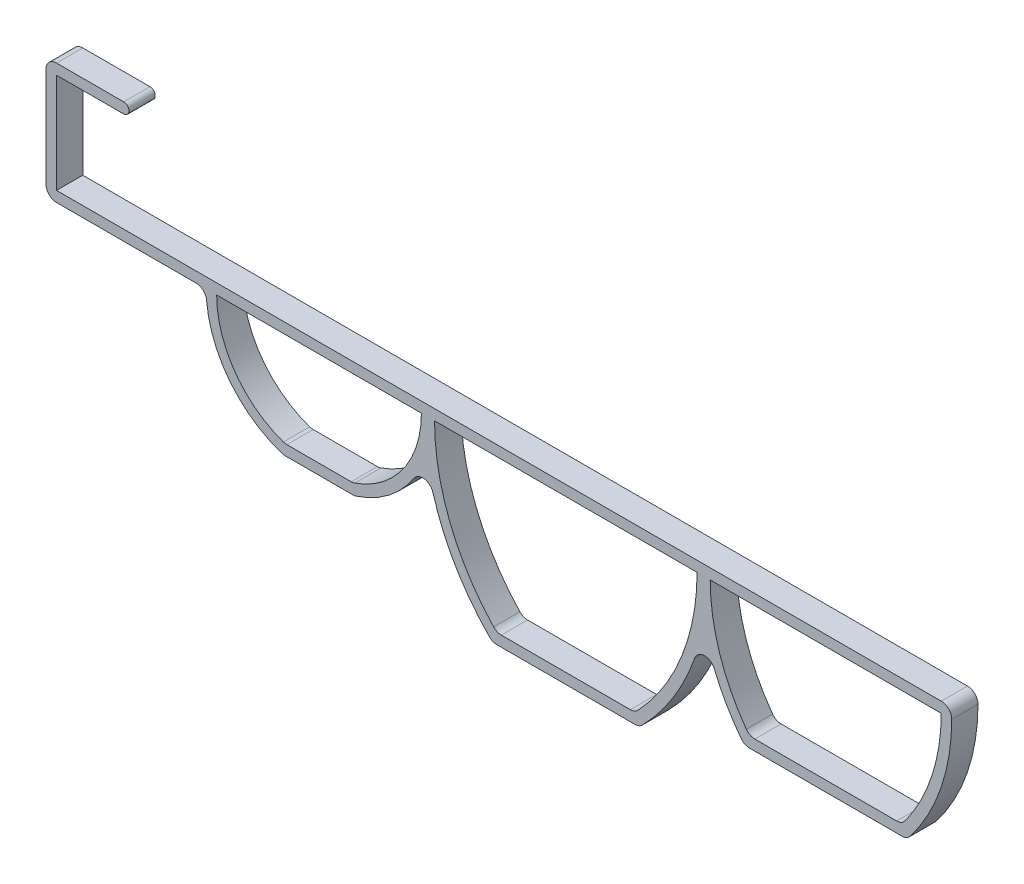
from build123d import *

# Parameters (mm, degrees)
BOSS_EXTRUDE1_DEPTH = 5
FILLET1_R           = 2
FILLET2_R           = 1


with BuildPart() as part:
    # Sketch1 → Boss-Extrude1 (new body)
    with BuildSketch(Plane.XY):
        with BuildLine():
            Line((45.947382797642085, 2), (-124.5, 1.9999999999999962))
            Line((-124.5, 1.9999999999999962), (-124.5, 20.99999999999999))
            Line((-124.5, 20.99999999999999), (-109.6965869966638, 20.999999999999993))
            Line((-109.6965869966638, 20.999999999999993), (-109.6965869966638, 22.99999999999999))
            Line((-109.6965869966638, 22.99999999999999), (-126.5, 22.99999999999999))
            Line((-126.5, 22.99999999999999), (-126.5, -3.98e-15))
            Line((-126.5, -3.98e-15), (-96.00000000000003, -5.01e-15))
            ThreePointArc((-96.00000000000003, -1.3922e-13), (-91.91634498174992, -12.422936572760829), (-81.25831039658792, -19.999999999999993))
            Line((-81.25831039658792, -19.999999999999996), (-67.7416896034121, -19.999999999999996))
            ThreePointArc((-67.7416896034121, -20), (-59.22674645064795, -14.898875979359843), (-54.01801901082011, -6.449326782725662))
            ThreePointArc((-54.01801901082044, -6.449326782725638), (-49.745600463821845, -19.747926884371328), (-41.46929842095424, -31.000000000000007))
            Line((-41.46929842095423, -31), (-13.530701579045768, -31))
            ThreePointArc((-13.530701579045765, -31.000000000000004), (-5.5615533236631265, -20.33765705801185), (-1.1997684126617827, -7.76118245981885))
            ThreePointArc((-1.1997684126617756, -7.761182459818851), (1.6903832669508674, -16.34383705889386), (6.527542114603506, -24))
            Line((6.527542114603509, -24), (37.47245788539651, -24))
            ThreePointArc((37.47245788539651, -24), (44.12729350691807, -11.787963694678155), (45.947382797642085, 2))
        make_face()
        with BuildLine():
            ThreePointArc((-55.000000000000014, -3.1e-16), (-58.606442943263986, -11.117096597214955), (-68.05217786452643, -18))
            Line((-68.05217786452643, -18), (-80.94782213547359, -18))
            ThreePointArc((-80.94782213547359, -18.000000000000004), (-90.39355705673603, -11.117096597214955), (-94, -5.08e-15))
            Line((-94, -5.08e-15), (-55.00000000000001, -3.1e-16))
        make_face(mode=Mode.SUBTRACT)
        with BuildLine():
            ThreePointArc((-2.499999999999993, 0), (-5.579078670022007, -15.665382277262486), (-14.358195797467605, -28.999999999999996))
            Line((-14.358195797467618, -29), (-40.641804202532384, -29))
            ThreePointArc((-40.641804202532384, -29), (-49.420921329978, -15.665382277262491), (-52.500000000000014, 0))
            Line((-52.50000000000001, 0), (-2.5, 0))
        make_face(mode=Mode.SUBTRACT)
        with BuildLine():
            ThreePointArc((7.494737611193308, -21.999999999999993), (1.9251046025075595, -11.620790548201041), (0, 0))
            Line((0, 0), (44, 0))
            ThreePointArc((44, 0), (42.07489539749246, -11.620790548201052), (36.5052623888067, -22))
            Line((36.50526238880669, -22), (7.494737611193305, -21.999999999999986))
        make_face(mode=Mode.SUBTRACT)
    extrude(amount=BOSS_EXTRUDE1_DEPTH)

    # Fillet1
    # the kernel refuses this fillet: 2 mm, written as the material it adds along each edge
    with BuildSketch(Plane(origin=(7.494737611193306, -21.99999999999999, 0), x_dir=(-0.5991062369957058, 0.8006695428157894, 0), z_dir=(0, 0, 1))) as fillet1_piece_1:
        with BuildLine():
            CenterArc((1.0015491764552975, -1.9997957036664622), FILLET1_R, 89.18105145509278, 54.01303517716653)
            Line((-0.5997899091731567, -0.8015832296708748), (0, 0))
            ThreePointArc((0, 0), (0.5150674500576004, 0.00368108195627573), (1.030134900115199, -5e-17))
        make_face()
    extrude(amount=5)
    with BuildSketch(Plane(origin=(36.5052623888067, -22, 0), x_dir=(0.599106236995708, 0.8006695428157878, 0), z_dir=(0, 0, 1))) as fillet1_piece_2:
        with BuildLine():
            CenterArc((1.0015491764552726, 1.9997957036664615), FILLET1_R, 216.80591336773654, 54.01303517717065)
            Line((-0.5997899091732678, 0.8015832296709893), (0, 0))
            ThreePointArc((0, 0), (0.5150674500575887, -0.00368108195627645), (1.0301349001151745, 4e-17))
        make_face()
    extrude(amount=5)
    with BuildSketch(Plane(origin=(-1.1997684126617827, -7.7611824598188495, 0), x_dir=(-0.2559607440844839, -0.9666871766438806, 0), z_dir=(0, 0, 1))) as fillet1_piece_3:
        with BuildLine():
            CenterArc((7.006516264382127, 1.9937618524445377), FILLET1_R, 126.90247774602503, 138.57101311365483)
            ThreePointArc((5.80560665040515, 3.593079237786693), (2.9835854859434217, 1.6660138445939616), (0, 0))
            ThreePointArc((0, 0), (3.424337799359584, 0.13533600091225512), (6.84867559871917, -3e-17))
        make_face()
    extrude(amount=5)
    with BuildSketch(Plane(origin=(-14.358195797467612, -29, 0), x_dir=(0.6930946226970236, 0.720846616131664, 0), z_dir=(0, 0, 1))) as fillet1_piece_4:
        with BuildLine():
            CenterArc((0.8516205484031373, 1.9998888522074818), FILLET1_R, 223.8755770631898, 46.728475963226686)
            Line((-0.5900726838592292, 0.6136996068124346), (0, 0))
            ThreePointArc((0, 0), (0.4363527930685471, -0.00230019269212628), (0.8727055861370968, 1e-17))
        make_face()
    extrude(amount=5)
    with BuildSketch(Plane(origin=(-40.641804202532384, -29, 0), x_dir=(1, 0, 0), z_dir=(0, 0, 1))) as fillet1_piece_5:
        with BuildLine():
            CenterArc((0.8513594890752856, 2), FILLET1_R, 223.27152403673355, 46.72847596326642)
            ThreePointArc((-0.6048675489506863, 0.629086868644805), (-0.3040918605932177, 0.3129491831369968), (0, 0))
            Line((0, 0), (0.8513594890752856, 0))
        make_face()
    extrude(amount=5)
    with BuildSketch(Plane(origin=(-54.01801901082027, -6.449326782725651, 0), x_dir=(-0.4311999989802577, -0.9022563720359229, 0), z_dir=(0, 0, 1))) as fillet1_piece_6:
        with BuildLine():
            CenterArc((5.805573723556372, 1.9824143967569778), FILLET1_R, 131.58462794743895, 130.81175906112728)
            ThreePointArc((4.4781226039186794, 3.478366777340206), (2.2959426874147386, 1.6659530957609738), (0, 0))
            ThreePointArc((0, 0), (2.7704679671233965, 0.18410201579468238), (5.540935934246784, 1.2e-16))
        make_face()
    extrude(amount=5)
    with BuildSketch(Plane(origin=(-68.05217786452643, -18, 0), x_dir=(0.9475954690279733, 0.3194727329173106, 0), z_dir=(0, 0, 1))) as fillet1_piece_7:
        with BuildLine():
            CenterArc((0.3283173010527549, 1.9999162475023402), FILLET1_R, 251.36895898872925, 19.155393135414442)
            Line((-0.31062816478187977, 0.10472530944639823), (0, 0))
            ThreePointArc((0, 0), (0.17331019378626858, -0.00079304447276945), (0.34662038757253955, 0))
        make_face()
    extrude(amount=5)
    with BuildSketch(Plane(origin=(-80.94782213547359, -18.000000000000004, 0), x_dir=(1, 1.084e-14, 0), z_dir=(0, 0, 1))) as fillet1_piece_8:
        with BuildLine():
            CenterArc((0.32780672231424324, 2), FILLET1_R, 250.84460686458493, 19.155393135414442)
            ThreePointArc((-0.32845590873647146, 0.11073576250266372), (-0.1644813104532966, 0.05461639590219925), (0, 0))
            Line((0, 0), (0.3278067223142216, 0))
        make_face()
    extrude(amount=5)
    with BuildSketch(Plane(origin=(-96.00000000000003, -7.212e-14, 0), x_dir=(-1, 3.515e-14, 0), z_dir=(0, 0, 1))) as fillet1_piece_9:
        with BuildLine():
            CenterArc((1.912641367901373, 2), FILLET1_R, 185.00210139930942, 84.99789860069257)
            ThreePointArc((-0.07974163383531896, 1.82561544107731), (-0.01994490800398211, 0.9136780706116656), (0, 0))
            Line((0, 0), (1.9126413679014433, 0))
        make_face()
    extrude(amount=5)
    # the kernel refuses this fillet: 2 mm, written as the material it takes off along each edge
    with BuildSketch(Plane(origin=(45.947382797642085, 2.000000000000002, -5.001730056930275), x_dir=(0.026299501252087354, -0.9996541082964104, 0), z_dir=(0, 0, 1))) as fillet1_2_piece_1:
        with BuildLine():
            CenterArc((1.9480930202679383, -1.9993082165928209), FILLET1_R, 88.4929758152285, 89.9999999999682)
            Line((-0.05121519632485345, -1.9467092140875382), (0, 0))
            ThreePointArc((0, 0), (1.0003460113860576, 0.01315657596471321), (2.0006920227721112, 0))
        make_face()
    extrude(amount=15.003460113860552, mode=Mode.SUBTRACT)
    with BuildSketch(Plane(origin=(37.47245788539651, -24, -2.4841807127470568), x_dir=(-1, 0, 0), z_dir=(0, 0, 1))) as fillet1_2_piece_2:
        with BuildLine():
            CenterArc((0.9671954965845302, -2), FILLET1_R, 90, 52.37513808750745)
            ThreePointArc((-0.6168541298615224, -0.7790222029225369), (-0.3109710749573793, -0.3874966748050994), (0, 0))
            Line((0, 0), (0.9671954965845302, 0))
        make_face()
    extrude(amount=9.968361425494114, mode=Mode.SUBTRACT)
    with BuildSketch(Plane(origin=(6.527542114603495, -24, -2.484180712746931), x_dir=(-0.6207822630344314, 0.7839830239883068, 0), z_dir=(0, 0, 1))) as fillet1_2_piece_3:
        with BuildLine():
            CenterArc((0.9675482388101264, -1.9998293762732642), FILLET1_R, 89.2515799187701, 52.375138087411486)
            Line((-0.60041780916442, -0.7582648502017908), (0, 0))
            ThreePointArc((0, 0), (0.4968361425493905, 0.00324498101414436), (0.993672285098762, -4e-17))
        make_face()
    extrude(amount=9.96836142549386, mode=Mode.SUBTRACT)
    with BuildSketch(Plane(origin=(-13.53070157904575, -31, -2.118127681372563), x_dir=(-1, 0, 0), z_dir=(0, 0, 1))) as fillet1_2_piece_4:
        with BuildLine():
            CenterArc((0.8274942184199716, -2), FILLET1_R, 90, 45.520369910435846)
            ThreePointArc((-0.5995049670605166, -0.598688712441799), (-0.30121380534773223, -0.29788104203134225), (0, 0))
            Line((0, 0), (0.8274942184199716, 0))
        make_face()
    extrude(amount=9.236255362745126, mode=Mode.SUBTRACT)
    with BuildSketch(Plane(origin=(-41.469298420954246, -31, -2.118127681372557), x_dir=(1, 0, 0), z_dir=(0, 0, 1))) as fillet1_2_piece_5:
        with BuildLine():
            CenterArc((0.8274942184200782, 2), FILLET1_R, 224.47963008956205, 45.52036991043792)
            ThreePointArc((-0.5995049670604615, 0.5986887124418523), (-0.3012138053477287, 0.29788104203132804), (0, 0))
            Line((0, 0), (0.8274942184200782, 0))
        make_face()
    extrude(amount=9.236255362745114, mode=Mode.SUBTRACT)
    with BuildSketch(Plane(origin=(-67.7416896034121, -19.999999999999996, -0.8161799892839701), x_dir=(-1, 0, 0), z_dir=(0, 0, 1))) as fillet1_2_piece_6:
        with BuildLine():
            CenterArc((0.3104882611143438, -2), FILLET1_R, 90, 18.10668888712732)
            ThreePointArc((-0.3110865262256084, -0.09904108836006387), (-0.15573630283404327, -0.04891420940217017), (0, 0))
            Line((0, 0), (0.3104882611143438, 0))
        make_face()
    extrude(amount=6.632359978548406, mode=Mode.SUBTRACT)
    with BuildSketch(Plane(origin=(-81.25831039658793, -19.999999999999993, -0.8161799892839283), x_dir=(-0.9528735398862427, 0.3033677916072522, 0), z_dir=(0, 0, 1))) as fillet1_2_piece_7:
        with BuildLine():
            CenterArc((0.3108795347533545, -1.9999392178667164), FILLET1_R, 89.55330437229577, 18.106688887126865)
            Line((-0.2958560484611499, -0.09419213809423096), (0, 0))
            ThreePointArc((0, 0), (0.16323599785482176, 0.00063632240005913), (0.32647199570966445, 0))
        make_face()
    extrude(amount=6.632359978548333, mode=Mode.SUBTRACT)
    with BuildSketch(Plane(origin=(-109.6965869966638, 20.999999999999993, -5), x_dir=(-1, 0, 0), z_dir=(0, 0, 1)), Plane(origin=(-126.5, 22.99999999999999, -5), x_dir=(1, 0, 0), z_dir=(0, 0, 1))) as fillet1_2_piece_8:
        with BuildLine():
            CenterArc((FILLET1_R, -FILLET1_R), FILLET1_R, 90, 90)
            Line((0, -FILLET1_R), (0, 0))
            Line((0, 0), (FILLET1_R, 0))
        make_face()
    extrude(amount=15, mode=Mode.SUBTRACT)
    with BuildSketch(Plane(origin=(-109.6965869966638, 22.99999999999999, -5), x_dir=(0, -1, 0), z_dir=(0, 0, 1))) as fillet1_2_piece_9:
        with BuildLine():
            CenterArc((FILLET1_R, -FILLET1_R), FILLET1_R, 90, 90)
            Line((0, -FILLET1_R), (0, 0))
            Line((0, 0), (FILLET1_R, 0))
        make_face()
    extrude(amount=15, mode=Mode.SUBTRACT)
    with BuildSketch(Plane(origin=(-126.5, -3.55e-15, -5.000000000000001), x_dir=(0, 1, 0), z_dir=(0, 0, 1))) as fillet1_2_piece_10:
        with BuildLine():
            CenterArc((FILLET1_R, -FILLET1_R), FILLET1_R, 90, 90)
            Line((0, -FILLET1_R), (0, 0))
            Line((0, 0), (FILLET1_R, 0))
        make_face()
    extrude(amount=15, mode=Mode.SUBTRACT)

    # Fillet2
    # the kernel refuses this fillet: 1 mm, written as the material it takes off along each edge
    with BuildSketch(Plane(origin=(-109.96453618909511, 22, 9.999988187015607), x_dir=(-0.8660247217603869, -0.5000011812984491, 0), z_dir=(0, 0, -1))) as fillet2_piece_1:
        with BuildLine():
            CenterArc((1.4999964561018568, 0.8660260858068783), FILLET2_R, 120.0002344623185, 179.99968738357467)
            ThreePointArc((0.9999929122093405, 1.7320494435143525), (0.2679464643438091, 0.9999980028954786), (0, 0))
            ThreePointArc((0, 0), (0.9999976374012411, -0.26794782838624004), (1.999995274802482, 1.4e-16))
        make_face()
    extrude(amount=14.999976374031213, mode=Mode.SUBTRACT)


solid = part.part
